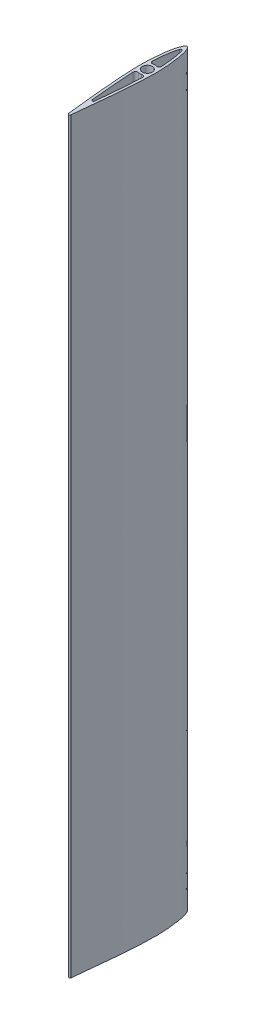
from build123d import *

# Parameters (mm, degrees)
SKETCH1_R           = 2
BOSS_EXTRUDE1_DEPTH = 300
SHELL1_DEPTH        = 300
FILLET1_R           = 1
FILLET2_R           = 0.5


# Read off the part's stored shape, not the designer's step: Shell1
with BuildPart() as part:
    # Sketch1 → Boss-Extrude1 (new body)
    with BuildSketch(Plane(origin=(0, 0, 0), x_dir=(1, 0, 0), z_dir=(0, 1, 0))):
        with BuildLine():
            ThreePointArc((-0.496785928, -31.056601607), (0, -31.5), (0.496785928, -31.056601607))
            add(Edge.make_bspline(
                [(0, 16), (0.743965245, 16), (2.652961995, 12.540594416), (3.184659055, -4.397503105), (1.685419672, -20.624097122), (0.496785928, -31.056601607)],
                knots=[0, 0, 0, 0, 0.615228924, 0.71442429, 0.99195366, 0.99195366, 0.99195366, 0.99195366], degree=3))
            add(Edge.make_bspline(
                [(0, 16), (-0.743965245, 16), (-2.652961995, 12.540594416), (-3.184659055, -4.397503105), (-1.685419672, -20.624097122), (-0.496785928, -31.056601607)],
                knots=[0, 0, 0, 0, 0.615228924, 0.71442429, 0.99195366, 0.99195366, 0.99195366, 0.99195366], degree=3))
        make_face()
        with Locations(Location((0, 0, 0), (0, 0, 270))):
            Circle(SKETCH1_R, mode=Mode.SUBTRACT)
    extrude(amount=BOSS_EXTRUDE1_DEPTH)

    # Shell1 outline → Shell1 (cut)
    with BuildSketch(Plane(origin=(0, 0, 0), x_dir=(1, 0, 0), z_dir=(0, 1, 0))):
        with BuildLine():
            ThreePointArc((-1.95839418, 2.272595925), (0, 3), (1.95839418, 2.272595925))
            add(Edge.make_bspline(
                [(1.95839418, 2.272595925), (1.955529362, 2.350174016), (1.952578939, 2.427275814), (1.949545514, 2.503917797), (1.94643165, 2.580116643), (1.943239903, 2.655889023), (1.939972828, 2.731251602), (1.936632974, 2.806221036), (1.93322289, 2.880813975), (1.929745119, 2.955047062), (1.926202201, 3.028936934), (1.922596671, 3.10250022), (1.918931064, 3.175753541), (1.915207909, 3.248713514), (1.908980868, 3.3685071), (1.906509452, 3.415489405), (1.904010667, 3.46245801), (1.901510489, 3.508947582), (1.898941566, 3.556121028), (1.896415763, 3.60229664), (1.893833882, 3.648759656), (1.891220776, 3.695337203), (1.888630733, 3.741244299), (1.885978354, 3.787521502), (1.883332168, 3.833418817), (1.880656567, 3.879292842), (1.877964009, 3.925030487), (1.872539803, 4.016277802), (1.869808428, 4.061785376), (1.867057854, 4.107176984), (1.864288154, 4.152452743), (1.861499402, 4.197612769), (1.85869167, 4.24265718), (1.855865032, 4.287586092), (1.853019561, 4.332399623), (1.85015533, 4.377097888), (1.847272412, 4.421681006), (1.844370881, 4.466149094), (1.841450809, 4.510502267), (1.83851227, 4.554740643), (1.823727602, 4.775359123), (1.811605485, 4.950019133), (1.799193713, 5.122851786), (1.786497013, 5.293864502), (1.773520113, 5.463064697), (1.76026774, 5.630459792), (1.746744622, 5.796057204), (1.732955486, 5.959864351), (1.71890506, 6.121888651), (1.704598072, 6.282137525), (1.690039248, 6.440618388), (1.675233318, 6.59733866), (1.660185007, 6.75230576), (1.553644817, 7.820228719), (1.453914609, 8.672713422), (1.346801911, 9.464515326), (1.233039126, 10.197302567), (1.114349973, 10.872312618), (0.990773931, 11.491511416), (0.864438787, 12.055842165), (0.735833305, 12.567115737), (0.606353667, 13.026481995), (0.477319511, 13.435259259), (0.350132773, 13.79453539), (0.226509896, 14.105239491), (0.108597578, 14.367880213), (-2.28e-07, 14.582441721)],
                knots=[0.350569181, 0.350569181, 0.350569181, 0.350569181, 0.350569181, 0.350569181, 0.350569181, 0.350569181, 0.350569181, 0.350569181, 0.350569181, 0.350569181, 0.350569181, 0.350569181, 0.350569181, 0.372684101, 0.372684101, 0.372684101, 0.372684101, 0.372684101, 0.372684101, 0.372684101, 0.372684101, 0.372684101, 0.372684101, 0.372684101, 0.372684101, 0.372684101, 0.387018105, 0.387018105, 0.387018105, 0.387018105, 0.387018105, 0.387018105, 0.387018105, 0.387018105, 0.387018105, 0.387018105, 0.387018105, 0.387018105, 0.387018105, 0.401352108, 0.401352108, 0.401352108, 0.401352108, 0.401352108, 0.401352108, 0.401352108, 0.401352108, 0.401352108, 0.401352108, 0.401352108, 0.401352108, 0.401352108, 0.458688124, 0.458688124, 0.458688124, 0.458688124, 0.458688124, 0.458688124, 0.458688124, 0.458688124, 0.458688124, 0.458688124, 0.458688124, 0.458688124, 0.458688124, 0.80097298, 0.80097298, 0.80097298, 0.80097298, 0.80097298, 0.80097298, 0.80097298, 0.80097298, 0.80097298, 0.80097298, 0.80097298, 0.80097298, 0.80097298, 0.80097298, 0.80097298], degree=14))
            add(Edge.make_bspline(
                [(-2.28e-07, 14.582441721), (-0.108597578, 14.367880213), (-0.226509896, 14.105239491), (-0.350132773, 13.79453539), (-0.477319511, 13.435259259), (-0.606353667, 13.026481995), (-0.735833305, 12.567115737), (-0.864438787, 12.055842165), (-0.990773931, 11.491511416), (-1.114349973, 10.872312618), (-1.233039126, 10.197302567), (-1.346801911, 9.464515326), (-1.453914609, 8.672713422), (-1.553644817, 7.820228719), (-1.660185007, 6.75230576), (-1.675233318, 6.59733866), (-1.690039248, 6.440618388), (-1.704598072, 6.282137525), (-1.71890506, 6.121888651), (-1.732955486, 5.959864351), (-1.746744622, 5.796057203), (-1.76026774, 5.630459792), (-1.773520113, 5.463064697), (-1.786497013, 5.293864502), (-1.799193713, 5.122851786), (-1.811605485, 4.950019133), (-1.823727602, 4.775359123), (-1.83851227, 4.554740643), (-1.841450809, 4.510502267), (-1.844370881, 4.466149094), (-1.847272412, 4.421681006), (-1.85015533, 4.377097888), (-1.853019561, 4.332399623), (-1.855865032, 4.287586092), (-1.85869167, 4.24265718), (-1.861499402, 4.197612769), (-1.864288154, 4.152452743), (-1.867057854, 4.107176984), (-1.869808428, 4.061785376), (-1.872539803, 4.016277802), (-1.877964009, 3.925030487), (-1.880656567, 3.879292842), (-1.883332168, 3.833418817), (-1.885978354, 3.787521502), (-1.888630733, 3.741244299), (-1.891220776, 3.695337203), (-1.893833882, 3.648759656), (-1.896415763, 3.602296639), (-1.898941566, 3.556121028), (-1.901510489, 3.508947582), (-1.904010667, 3.46245801), (-1.906509452, 3.415489405), (-1.908980868, 3.3685071), (-1.915207909, 3.248713514), (-1.918931064, 3.175753541), (-1.922596671, 3.10250022), (-1.926202201, 3.028936934), (-1.929745119, 2.955047062), (-1.93322289, 2.880813975), (-1.936632974, 2.806221036), (-1.939972828, 2.731251602), (-1.943239903, 2.655889023), (-1.94643165, 2.580116643), (-1.949545514, 2.503917797), (-1.952578939, 2.427275814), (-1.955529362, 2.350174016), (-1.95839418, 2.272595925)],
                knots=[0.19098068, 0.19098068, 0.19098068, 0.19098068, 0.19098068, 0.19098068, 0.19098068, 0.19098068, 0.19098068, 0.19098068, 0.19098068, 0.19098068, 0.19098068, 0.19098068, 0.19098068, 0.533265536, 0.533265536, 0.533265536, 0.533265536, 0.533265536, 0.533265536, 0.533265536, 0.533265536, 0.533265536, 0.533265536, 0.533265536, 0.533265536, 0.533265536, 0.590601551, 0.590601551, 0.590601551, 0.590601551, 0.590601551, 0.590601551, 0.590601551, 0.590601551, 0.590601551, 0.590601551, 0.590601551, 0.590601551, 0.590601551, 0.604935555, 0.604935555, 0.604935555, 0.604935555, 0.604935555, 0.604935555, 0.604935555, 0.604935555, 0.604935555, 0.604935555, 0.604935555, 0.604935555, 0.604935555, 0.619269559, 0.619269559, 0.619269559, 0.619269559, 0.619269559, 0.619269559, 0.619269559, 0.619269559, 0.619269559, 0.619269559, 0.619269559, 0.619269559, 0.619269559, 0.641384479, 0.641384479, 0.641384479, 0.641384479, 0.641384479, 0.641384479, 0.641384479, 0.641384479, 0.641384479, 0.641384479, 0.641384479, 0.641384479, 0.641384479, 0.641384479, 0.641384479], degree=14))
        make_face()
        with BuildLine():
            add(Edge.make_bspline(
                [(-1.963893109, -2.267845763), (-1.963656896, -2.275635192), (-1.963419802, -2.283429815), (-1.963181829, -2.291229632), (-1.962942976, -2.299034646), (-1.962703243, -2.306844859), (-1.96246263, -2.314660276), (-1.962221137, -2.322480902), (-1.961978764, -2.330306739), (-1.961735511, -2.338137789), (-1.96149138, -2.34597405), (-1.961246369, -2.353815513), (-1.961000482, -2.361662156), (-1.96075372, -2.369513947), (-1.95814715, -2.452214362), (-1.955708691, -2.527526397), (-1.953191007, -2.60330408), (-1.950594399, -2.679544556), (-1.947919167, -2.75624497), (-1.945165611, -2.833402466), (-1.942334032, -2.91101419), (-1.939424728, -2.989077285), (-1.936438001, -3.067588897), (-1.93337415, -3.14654617), (-1.930233476, -3.225946249), (-1.927016278, -3.305786279), (-1.923722857, -3.386063404), (-1.913614825, -3.6281975), (-1.90657248, -3.791357511), (-1.899228932, -3.956232427), (-1.891586643, -4.122799947), (-1.883648081, -4.29103785), (-1.875415721, -4.460923992), (-1.866892043, -4.632436306), (-1.858079535, -4.805552802), (-1.848980692, -4.98025157), (-1.839598014, -5.156510776), (-1.82993401, -5.334308663), (-1.819991192, -5.513623554), (-1.809772082, -5.694433847), (-1.729721296, -7.085090924), (-1.648132362, -8.358228356), (-1.555246961, -9.689846095), (-1.451804557, -11.073747563), (-1.338546753, -12.503788742), (-1.216215808, -13.973856499), (-1.085553998, -15.477856226), (-0.947303466, -17.009705368), (-0.8022063, -18.56333022), (-0.651004642, -20.13266404), (-0.494440749, -21.711645303), (-0.333256981, -23.294215625), (-0.168195812, -24.874317648), (1e-09, -26.44589387)],
                knots=[0.718102839, 0.718102839, 0.718102839, 0.718102839, 0.718102839, 0.718102839, 0.718102839, 0.718102839, 0.718102839, 0.718102839, 0.718102839, 0.718102839, 0.718102839, 0.718102839, 0.718102839, 0.719607586, 0.719607586, 0.719607586, 0.719607586, 0.719607586, 0.719607586, 0.719607586, 0.719607586, 0.719607586, 0.719607586, 0.719607586, 0.719607586, 0.719607586, 0.73394159, 0.73394159, 0.73394159, 0.73394159, 0.73394159, 0.73394159, 0.73394159, 0.73394159, 0.73394159, 0.73394159, 0.73394159, 0.73394159, 0.73394159, 0.762609598, 0.762609598, 0.762609598, 0.762609598, 0.762609598, 0.762609598, 0.762609598, 0.762609598, 0.762609598, 0.762609598, 0.762609598, 0.762609598, 0.762609598, 0.952651571, 0.952651571, 0.952651571, 0.952651571, 0.952651571, 0.952651571, 0.952651571, 0.952651571, 0.952651571, 0.952651571, 0.952651571, 0.952651571, 0.952651571, 0.952651571, 0.952651571], degree=14))
            add(Edge.make_bspline(
                [(1e-09, -26.44589387), (0.168195812, -24.874317648), (0.333256981, -23.294215625), (0.494440749, -21.711645303), (0.651004642, -20.13266404), (0.8022063, -18.56333022), (0.947303466, -17.009705368), (1.085553998, -15.477856226), (1.216215808, -13.973856499), (1.338546753, -12.503788742), (1.451804557, -11.073747563), (1.555246961, -9.689846095), (1.648132362, -8.358228356), (1.729721296, -7.085090924), (1.809772082, -5.694433847), (1.819991192, -5.513623554), (1.82993401, -5.334308663), (1.839598014, -5.156510776), (1.848980692, -4.98025157), (1.858079535, -4.805552802), (1.866892043, -4.632436306), (1.875415721, -4.460923992), (1.883648081, -4.291037851), (1.891586643, -4.122799947), (1.899228932, -3.956232427), (1.90657248, -3.791357511), (1.913614825, -3.6281975), (1.923722857, -3.386063404), (1.927016278, -3.305786279), (1.930233476, -3.225946249), (1.93337415, -3.14654617), (1.936438001, -3.067588897), (1.939424728, -2.989077285), (1.942334032, -2.91101419), (1.945165611, -2.833402466), (1.947919167, -2.75624497), (1.950594399, -2.679544556), (1.953191007, -2.60330408), (1.955708691, -2.527526397), (1.95814715, -2.452214362), (1.96075372, -2.369513947), (1.961000482, -2.361662156), (1.961246369, -2.353815513), (1.96149138, -2.34597405), (1.961735511, -2.338137789), (1.961978764, -2.330306739), (1.962221137, -2.322480902), (1.96246263, -2.314660276), (1.962703243, -2.306844859), (1.962942976, -2.299034646), (1.963181829, -2.291229632), (1.963419802, -2.283429815), (1.963656896, -2.275635192), (1.963893109, -2.267845763)],
                knots=[0.039302088, 0.039302088, 0.039302088, 0.039302088, 0.039302088, 0.039302088, 0.039302088, 0.039302088, 0.039302088, 0.039302088, 0.039302088, 0.039302088, 0.039302088, 0.039302088, 0.039302088, 0.229344062, 0.229344062, 0.229344062, 0.229344062, 0.229344062, 0.229344062, 0.229344062, 0.229344062, 0.229344062, 0.229344062, 0.229344062, 0.229344062, 0.229344062, 0.25801207, 0.25801207, 0.25801207, 0.25801207, 0.25801207, 0.25801207, 0.25801207, 0.25801207, 0.25801207, 0.25801207, 0.25801207, 0.25801207, 0.25801207, 0.272346074, 0.272346074, 0.272346074, 0.272346074, 0.272346074, 0.272346074, 0.272346074, 0.272346074, 0.272346074, 0.272346074, 0.272346074, 0.272346074, 0.272346074, 0.273850821, 0.273850821, 0.273850821, 0.273850821, 0.273850821, 0.273850821, 0.273850821, 0.273850821, 0.273850821, 0.273850821, 0.273850821, 0.273850821, 0.273850821, 0.273850821, 0.273850821], degree=14))
            ThreePointArc((1.963893109, -2.267845763), (0, -3), (-1.963893109, -2.267845763))
        make_face()
    extrude(amount=SHELL1_DEPTH, mode=Mode.SUBTRACT)

    # Fillet1
    fillet1_edges = [part.edges().sort_by_distance(p)[0] for p in [
        (1.95839418, 150, -2.272595925),
        (1.963893109, 150, 2.267845763),
        (-1.95839418, 150, -2.272595925),
        (-1.963893109, 150, 2.267845763),
    ]]
    fillet(fillet1_edges, radius=FILLET1_R)

    # Fillet2
    fillet2_edges = [part.edges().sort_by_distance(p)[0] for p in [
        (-2.28e-07, 150, -14.582441721),
        (1e-09, 150, 26.44589387),
    ]]
    fillet(fillet2_edges, radius=FILLET2_R)


solid = part.part
